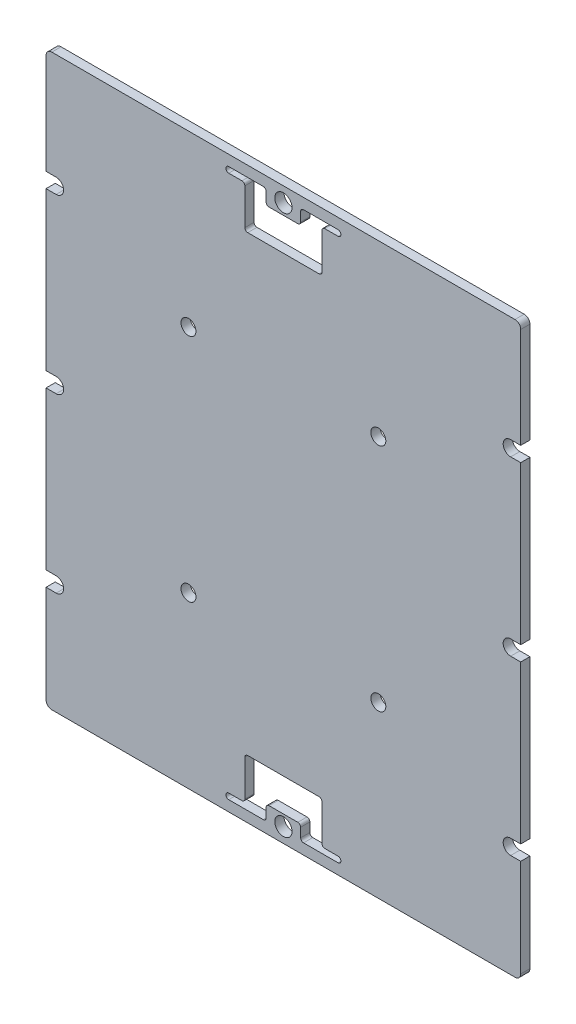
from build123d import *

# Parameters (mm, degrees)
SKETCH2_W            = 82.5
SKETCH2_H            = 99
SKETCH2_R            = 0.8
SKETCH2_R_2          = 1.5
PCB_EXTRUDE_DEPTH    = 0.8
CORNER_FILLETS_R     = 1
SKETCH4_R            = 1.5
SOLAR_HOLES_DEPTH    = 65.454421881
SOLAR_HOLE_FILLETS_R = 0.5
M2_CLEARANCE_HOLES_D = 2.6
SKETCH10_W           = 1.75
SKETCH10_H           = 2.6
CUT_EXTRUDE2_DEPTH   = 65.454421881


with BuildPart() as part:
    # Sketch2 → pcb extrude (new, symmetric)
    with BuildSketch(Plane.XY):
        Rectangle(SKETCH2_W, SKETCH2_H)
        with Locations((-39.5, -30.25)):
            Circle(SKETCH2_R, mode=Mode.SUBTRACT)
        with Locations((-39.5, -0.25)):
            Circle(SKETCH2_R, mode=Mode.SUBTRACT)
        with Locations((-16.5, -20)):
            Circle(SKETCH2_R, mode=Mode.SUBTRACT)
        with Locations((0, -46.95)):
            Circle(SKETCH2_R_2, mode=Mode.SUBTRACT)
        with Locations((39.5, -30.25)):
            Circle(SKETCH2_R, mode=Mode.SUBTRACT)
        with Locations((16.5, -20)):
            Circle(SKETCH2_R, mode=Mode.SUBTRACT)
        with Locations((39.5, -0.25)):
            Circle(SKETCH2_R, mode=Mode.SUBTRACT)
        with Locations((-16.5, 20)):
            Circle(SKETCH2_R, mode=Mode.SUBTRACT)
        with Locations((-39.5, 29.75)):
            Circle(SKETCH2_R, mode=Mode.SUBTRACT)
        with Locations((16.5, 20)):
            Circle(SKETCH2_R, mode=Mode.SUBTRACT)
        with Locations((0, 46.95)):
            Circle(SKETCH2_R, mode=Mode.SUBTRACT)
        with Locations((39.5, 29.75)):
            Circle(SKETCH2_R, mode=Mode.SUBTRACT)
    extrude(amount=PCB_EXTRUDE_DEPTH, both=True)

    # corner fillets
    corner_fillets_edges = [part.edges().sort_by_distance(p)[0] for p in [
        (41.25, -49.5, 0),
        (-41.25, -49.5, 0),
        (41.25, 49.5, 0),
        (-41.25, 49.5, 0),
    ]]
    fillet(corner_fillets_edges, radius=CORNER_FILLETS_R)

    # Sketch4 → solar holes (cut, through all)
    with BuildSketch(Plane.XY.offset(0.8)):
        with Locations((0, 46.95)):
            Circle(SKETCH4_R)
        with BuildLine():
            Line((6.7, 39.35), (-6.7, 39.35))
            Line((-6.7, 39.35), (-6.7, 46.65))
            Line((-6.7, 46.65), (-9.5, 46.65))
            ThreePointArc((-9.5, 46.65), (-10, 47.15), (-9.5, 47.65))
            Line((-9.5, 47.65), (-3, 47.65))
            Line((-3, 47.65), (-3, 45.05))
            Line((-3, 45.05), (3, 45.05))
            Line((3, 45.05), (3, 47.65))
            Line((3, 47.65), (9.5, 47.65))
            ThreePointArc((9.5, 47.65), (10, 47.15), (9.5, 46.65))
            Line((9.5, 46.65), (6.7, 46.65))
            Line((6.7, 46.65), (6.7, 39.35))
        make_face()
        with BuildLine():
            Line((6.7, -46.65), (9.5, -46.65))
            ThreePointArc((9.5, -46.65), (10, -47.15), (9.5, -47.65))
            Line((9.5, -47.65), (3, -47.65))
            Line((3, -47.65), (3, -45.05))
            Line((3, -45.05), (-3, -45.05))
            Line((-3, -45.05), (-3, -47.65))
            Line((-3, -47.65), (-9.5, -47.65))
            ThreePointArc((-9.5, -47.65), (-10, -47.15), (-9.5, -46.65))
            Line((-9.5, -46.65), (-6.7, -46.65))
            Line((-6.7, -46.65), (-6.7, -39.35))
            Line((-6.7, -39.35), (6.7, -39.35))
            Line((6.7, -39.35), (6.7, -46.65))
        make_face()
    extrude(amount=-SOLAR_HOLES_DEPTH, mode=Mode.SUBTRACT)

    # solar hole fillets
    solar_hole_fillets_edges = [part.edges().sort_by_distance(p)[0] for p in [
        (6.7, 46.65, 0),
        (3, 47.65, 0),
        (3, 45.05, 0),
        (6.7, 39.35, 0),
        (-6.7, 39.35, 0),
        (-6.7, 46.65, 0),
        (-3, 45.05, 0),
        (-3, 47.65, 0),
        (3, -47.65, 0),
        (3, -45.05, 0),
        (-3, -47.65, 0),
        (-3, -45.05, 0),
        (-6.7, -46.65, 0),
        (6.7, -46.65, 0),
        (6.7, -39.35, 0),
        (-6.7, -39.35, 0),
    ]]
    fillet(solar_hole_fillets_edges, radius=SOLAR_HOLE_FILLETS_R)

    # M2 Clearance Holes (through all)
    with Locations(Plane.XY.offset(0.8)):
        with Locations((-39.5, 29.75), (-39.5, -0.25), (-16.5, 20), (16.5, 20), (16.5, -20), (-16.5, -20), (39.5, 29.75), (39.5, -0.25), (39.5, -30.25), (-39.5, -30.25)):
            Hole(M2_CLEARANCE_HOLES_D / 2)

    # Sketch10 → Cut-Extrude2 (cut, through all)
    with BuildSketch(Plane.XY.offset(0.8)):
        with Locations((-40.375, 29.75)):
            Rectangle(SKETCH10_W, SKETCH10_H)
        with Locations((-40.375, -0.25)):
            Rectangle(SKETCH10_W, SKETCH10_H)
        with Locations((-40.375, -30.25)):
            Rectangle(SKETCH10_W, SKETCH10_H)
        with Locations((40.375, -30.25)):
            Rectangle(SKETCH10_W, SKETCH10_H)
        with Locations((40.375, -0.25)):
            Rectangle(SKETCH10_W, SKETCH10_H)
        with Locations((40.375, 29.75)):
            Rectangle(SKETCH10_W, SKETCH10_H)
    extrude(amount=-CUT_EXTRUDE2_DEPTH, mode=Mode.SUBTRACT)


solid = part.part
